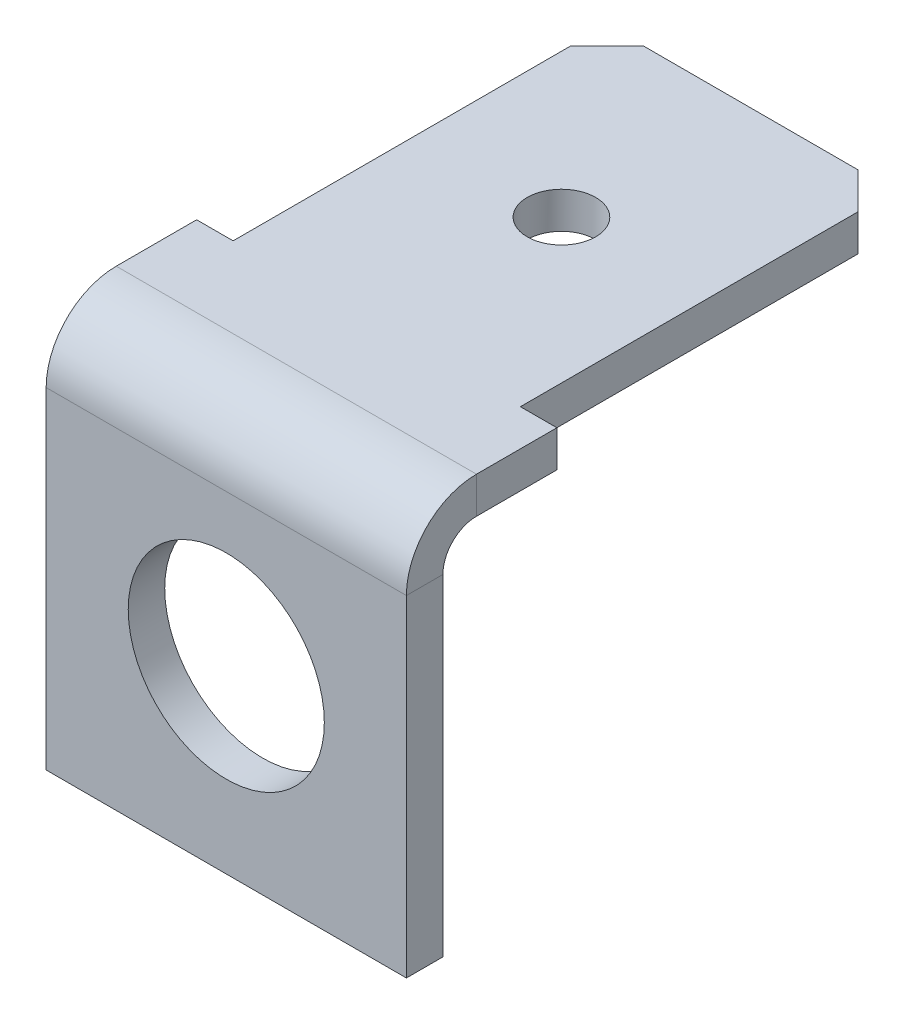
from build123d import *

# Parameters (mm, degrees)
SKETCH_1_W                       = 7.9
SKETCH_1_H                       = 8.8
SM_BASE_FLANGE_1_DEPTH           = 0.8
SM_EDGE_FLANGE_1_STRIP_W         = 4.6732
SM_EDGE_FLANGE_1_STRIP_H         = 0.8
SM_EDGE_FLANGE_1_STRIP_CUT_DEPTH = 7.9
SM_EDGE_FLANGE_1_DEPTH           = 7.9
SKETCH_7_R                       = 2.15
CUT_EXTRUDE_1_DEPTH              = 10
SKETCH_8_W                       = 0.8
SKETCH_8_H                       = 8.2
CUT_EXTRUDE_2_DEPTH              = 10
SKETCH_9_R                       = 0.75
CUT_EXTRUDE_3_DEPTH              = 10
CHAMFER_1_SIZE                   = 0.8


# Sheet-metal steps are written as plain solids
with BuildPart() as part:
    # Sketch 1 → 基体-法兰1 (new body)
    with BuildSketch(Plane.XY):
        Rectangle(SKETCH_1_W, SKETCH_1_H)
    extrude(amount=-SM_BASE_FLANGE_1_DEPTH)

    # 边线-法兰1 strip (across the edge) → 边线-法兰1 strip cut (cut)
    with BuildSketch(Plane(origin=(-3.95, 4.4, -0.8), x_dir=(0, -1, 0), z_dir=(1, 0, 0))):
        with Locations((-0.8, -0.4)):
            Rectangle(SM_EDGE_FLANGE_1_STRIP_W, SM_EDGE_FLANGE_1_STRIP_H)
    extrude(amount=SM_EDGE_FLANGE_1_STRIP_CUT_DEPTH, mode=Mode.SUBTRACT)

    # 边线-法兰1 section (across the edge) → 边线-法兰1 (add)
    with BuildSketch(Plane(origin=(-3.95, 4.4, -0.8), x_dir=(0, -1, 0), z_dir=(1, 0, 0))):
        with BuildLine():
            Line((0, 0.7366), (0, 10.7))
            Line((0, 10.7), (0.8, 10.7))
            Line((0.8, 10.7), (0.8, 0.7366))
            ThreePointArc((0.8, 0.7366), (1.015745145, 0.215745145), (1.5366, 0))
            Line((1.5366, 0), (1.5366, -0.8))
            ThreePointArc((1.5366, -0.8), (0.45005972, -0.34994028), (0, 0.7366))
        make_face()
    extrude(amount=SM_EDGE_FLANGE_1_DEPTH)

    # 草图7 → 切除-拉伸1 (cut)
    with BuildSketch(Plane(origin=(0, 0, -0.8), x_dir=(-1, 0, 0), z_dir=(0, 0, -1))):
        with Locations((0, -0.45)):
            Circle(SKETCH_7_R)
    extrude(amount=-CUT_EXTRUDE_1_DEPTH, mode=Mode.SUBTRACT)

    # 草图8 → 切除-拉伸2 (cut)
    with BuildSketch(Plane(origin=(0, 4.4, 0), x_dir=(1, 0, 0), z_dir=(0, 1, 0))):
        with Locations((3.55, 7.4)):
            Rectangle(SKETCH_8_W, SKETCH_8_H)
        with Locations((-3.55, 7.4)):
            Rectangle(SKETCH_8_W, SKETCH_8_H)
    extrude(amount=-CUT_EXTRUDE_2_DEPTH, mode=Mode.SUBTRACT)

    # 草图9 → 切除-拉伸3 (cut)
    with BuildSketch(Plane(origin=(0, 4.4, 0), x_dir=(1, 0, 0), z_dir=(0, 1, 0))):
        with Locations(Location((0, 7.35, 0), (0, 0, 270))):
            Circle(SKETCH_9_R)
    extrude(amount=-CUT_EXTRUDE_3_DEPTH, mode=Mode.SUBTRACT)

    # 倒角1
    chamfer_1_edges = [part.edges().sort_by_distance(p)[0] for p in [
        (-3.15, 4, -11.5),
        (3.15, 4, -11.5),
    ]]
    chamfer(chamfer_1_edges, length=CHAMFER_1_SIZE)


solid = part.part
